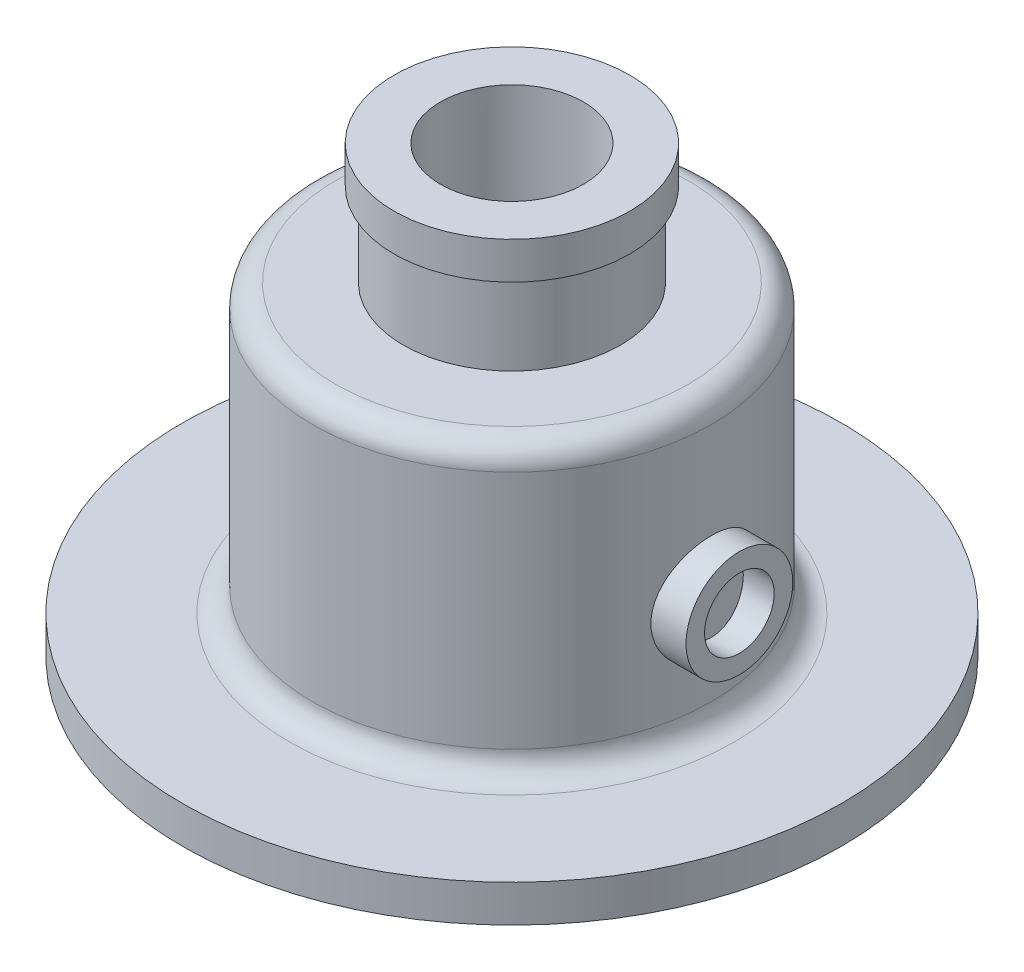
from build123d import *

# Parameters (mm, degrees)
SKETCH2_R           = 11.5
SKETCH2_R_2         = 7.5
BOSS_EXTRUDE1_DEPTH = 10
SKETCH4_R           = 7.5
CUT_EXTRUDE4_DEPTH  = 34
FILLET1_R           = 5
CHAMFER1_SIZE       = 2


# Read off the part's stored shape, not the designer's step: Revolve1
with BuildPart() as part:
    # Revolve1 outline → Revolve1 (revolve)
    with BuildSketch(Plane.XY):
        with BuildLine():
            Line((35, 18), (30, 18))
            ThreePointArc((30, 18), (26.464466094, 16.535533906), (25, 13))
            Line((25, 13), (25, 0))
            Line((25, 0), (32, 0))
            Line((32, 0), (32, 3))
            ThreePointArc((32, 3), (32.585786438, 4.414213562), (34, 5))
            Line((34, 5), (71, 5))
            Line((71, 5), (71, 13))
            Line((71, 13), (48, 13))
            ThreePointArc((48, 13), (44.464466094, 14.464466094), (43, 18))
            Line((43, 18), (43, 74.7))
            Line((43, 74.7), (23.4, 74.7))
            Line((23.4, 74.7), (23.4, 92.7))
            Line((23.4, 92.7), (25.4, 92.7))
            Line((25.4, 92.7), (25.4, 100.7))
            Line((25.4, 100.7), (15.4, 100.7))
            Line((15.4, 100.7), (15.4, 64.7))
            Line((15.4, 64.7), (23.4, 64.7))
            Line((23.4, 64.7), (23.4, 66.7))
            Line((23.4, 66.7), (35, 66.7))
            Line((35, 66.7), (35, 18))
        make_face()
    revolve(axis=Axis((0, 0, 0), (0, 1, 0)))



with BuildPart() as body_2:
    # Revolve1 2 outline → Revolve1 2 (revolve)
    with BuildSketch(Plane.XY):
        with BuildLine():
            Line((15.4, 100.7), (15.4, 64.7))
            Line((15.4, 64.7), (23.4, 64.7))
            Line((23.4, 64.7), (23.4, 66.7))
            Line((23.4, 66.7), (35, 66.7))
            Line((35, 66.7), (35, 23))
            ThreePointArc((35, 23), (33.535533906, 19.464466094), (30, 18))
            Line((30, 18), (25, 18))
            Line((25, 18), (25, 0))
            Line((25, 0), (32, 0))
            Line((32, 0), (32, 3))
            ThreePointArc((32, 3), (32.585786438, 4.414213562), (34, 5))
            Line((34, 5), (71, 5))
            Line((71, 5), (71, 13))
            Line((71, 13), (48, 13))
            ThreePointArc((48, 13), (44.464466094, 14.464466094), (43, 18))
            Line((43, 18), (43, 74.7))
            Line((43, 74.7), (23.4, 74.7))
            Line((23.4, 74.7), (23.4, 92.7))
            Line((23.4, 92.7), (25.4, 92.7))
            Line((25.4, 92.7), (25.4, 100.7))
            Line((25.4, 100.7), (15.4, 100.7))
        make_face()
    revolve(axis=Axis((0, 0, 0), (0, 1, 0)))


with BuildPart() as part_1:
    add(part.part)

    add(body_2.part)  # Boss-Extrude1 merges body 2
    # Sketch2 → Boss-Extrude1 (add)
    with BuildSketch(Plane(origin=(-49, 0, 0), x_dir=(0, 0, -1), z_dir=(1, 0, 0))):
        with Locations(Location((0, 37.5, 0), (0, 0, 180))):
            Circle(SKETCH2_R)
        with Locations(Location((0, 37.5, 0), (0, 0, 180))):
            Circle(SKETCH2_R_2, mode=Mode.SUBTRACT)
    boss_extrude1 = extrude(amount=BOSS_EXTRUDE1_DEPTH)

    # Sketch4 → Cut-Extrude4 (cut)
    with BuildSketch(Plane(origin=(-49, 0, 0), x_dir=(0, 0, -1), z_dir=(1, 0, 0))):
        with Locations(Location((0, 37.5, 0), (0, 0, 180))):
            Circle(SKETCH4_R)
    extrude(amount=CUT_EXTRUDE4_DEPTH, mode=Mode.SUBTRACT)

    # Mirror1: Boss-Extrude1 across plane
    add(boss_extrude1.mirror(Plane(origin=(0, 0, 0), x_dir=(0, 0, 1), z_dir=(1, 0, 0))))

    # Fillet1
    fillet1_edges = [part_1.edges().sort_by_distance(p)[0] for p in [
        (-43, 74.7, 0),
    ]]
    fillet(fillet1_edges, radius=FILLET1_R)

    # Chamfer1
    chamfer1_edges = [part_1.edges().sort_by_distance(p)[0] for p in [
        (-15.4, 64.7, 0),
    ]]
    chamfer(chamfer1_edges, length=CHAMFER1_SIZE)


solid = part_1.part
